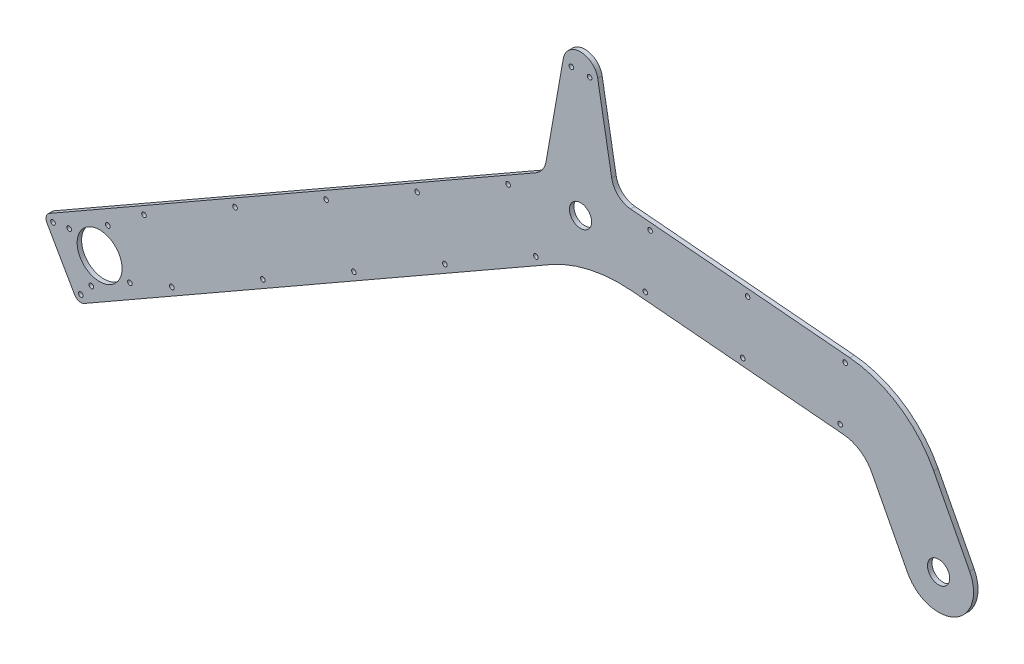
from build123d import *

# Parameters (mm, degrees)
SKETCH2_R         = 7.9375
SKETCH2_R_2       = 16.05
SKETCH2_R_3       = 1.65
BASE_DEPTH        = 3.175
SKETCH3_R         = 1.65
STRUT_HOLES_DEPTH = 448.434897902


with BuildPart() as part:
    # Sketch2 → Base (new body)
    with BuildSketch(Plane.XY):
        with BuildLine():
            Line((-379.716809958, -188.506893436), (-32.006532147, 10.487277971))
            ThreePointArc((-32.006532147, 10.487277971), (-27.186230121, 14.879084252), (-24.685038782, 20.901319377))
            Line((-24.685038782, 20.901319377), (-12.310096913, 91.083102221))
            ThreePointArc((-12.310096913, 91.083102221), (0, 101.4125), (12.310096913, 91.083102221))
            Line((12.310096913, 91.083102221), (22.322003955, 34.302755831))
            ThreePointArc((22.322003955, 34.302755831), (26.960267136, 25.848318444), (35.786784109, 21.964558025))
            Line((35.786784109, 21.964558025), (192.586144941, 8.246391504))
            ThreePointArc((192.586144941, 8.246391504), (227.717231711, -4.10798993), (252.575276723, -31.83706486))
            Line((252.575276723, -31.83706486), (278.255270829, -81.167874559))
            ThreePointArc((278.255270829, -81.167874559), (267.623715331, -114.886860719), (233.904729171, -104.255305221))
            Line((233.904729171, -104.255305221), (208.224735064, -54.924495522))
            ThreePointArc((208.224735064, -54.924495522), (199.93872006, -45.681470545), (188.228357804, -41.563343401))
            Line((188.228357804, -41.563343401), (36.823729736, -28.317154839))
            ThreePointArc((36.823729736, -28.317154839), (6.649577682, -30.266109959), (-21.562664076, -41.144864173))
            Line((-21.562664076, -41.144864173), (-354.881400189, -231.902773674))
            ThreePointArc((-354.881400189, -231.902773674), (-358.677364619, -232.387866435), (-361.70452919, -230.046726627))
            Line((-361.70452919, -230.046726627), (-381.572857005, -195.330022437))
            ThreePointArc((-381.572857005, -195.330022437), (-382.057949767, -191.534058007), (-379.716809958, -188.506893436))
        make_face()
        Circle(SKETCH2_R, mode=Mode.SUBTRACT)
        with Locations((-343.92, -196.825)):
            Circle(SKETCH2_R_2, mode=Mode.SUBTRACT)
        with Locations((-6.5, 88.9125)):
            Circle(SKETCH2_R_3, mode=Mode.SUBTRACT)
        with Locations((6.5, 88.9125)):
            Circle(SKETCH2_R_3, mode=Mode.SUBTRACT)
        with Locations((256.08, -92.71158989)):
            Circle(SKETCH2_R, mode=Mode.SUBTRACT)
        with Locations((-365.631063534, -190.919094461)):
            Circle(SKETCH2_R_3, mode=Mode.SUBTRACT)
        with Locations((-338.014094461, -175.113936466)):
            Circle(SKETCH2_R_3, mode=Mode.SUBTRACT)
        with Locations((-322.208936466, -202.730905539)):
            Circle(SKETCH2_R_3, mode=Mode.SUBTRACT)
        with Locations((-349.825905539, -218.536063534)):
            Circle(SKETCH2_R_3, mode=Mode.SUBTRACT)
    extrude(amount=BASE_DEPTH)

    # Sketch3 → Strut Holes (cut, through all)
    with BuildSketch(Plane.XY.offset(3.175)):
        with Locations((-357.364941166, -227.56318565)):
            Circle(SKETCH3_R)
        with Locations((-292.27112081, -190.310070996)):
            Circle(SKETCH3_R)
        with Locations((-227.177300453, -153.056956343)):
            Circle(SKETCH3_R)
        with Locations((-162.083480097, -115.803841689)):
            Circle(SKETCH3_R)
        with Locations((-96.98965974, -78.550727035)):
            Circle(SKETCH3_R)
        with Locations((-31.895839384, -41.297612382)):
            Circle(SKETCH3_R)
        with Locations((-312.139448625, -155.593366806)):
            Circle(SKETCH3_R)
        with Locations((-377.233268981, -192.84648146)):
            Circle(SKETCH3_R)
        with Locations((-247.045628268, -118.340252152)):
            Circle(SKETCH3_R)
        with Locations((-181.951807912, -81.087137499)):
            Circle(SKETCH3_R)
        with Locations((-116.857987555, -43.834022845)):
            Circle(SKETCH3_R)
        with Locations((-51.764167199, -6.580908192)):
            Circle(SKETCH3_R)
        with Locations((46.269308527, -24.124436716)):
            Circle(SKETCH3_R)
        with Locations((116.002937393, -30.225338708)):
            Circle(SKETCH3_R)
        with Locations((185.73656626, -36.326240701)):
            Circle(SKETCH3_R)
        with Locations((189.222795969, 3.521547223)):
            Circle(SKETCH3_R)
        with Locations((119.489167103, 9.622449215)):
            Circle(SKETCH3_R)
        with Locations((49.755538237, 15.723351208)):
            Circle(SKETCH3_R)
    extrude(amount=-STRUT_HOLES_DEPTH, mode=Mode.SUBTRACT)


solid = part.part
